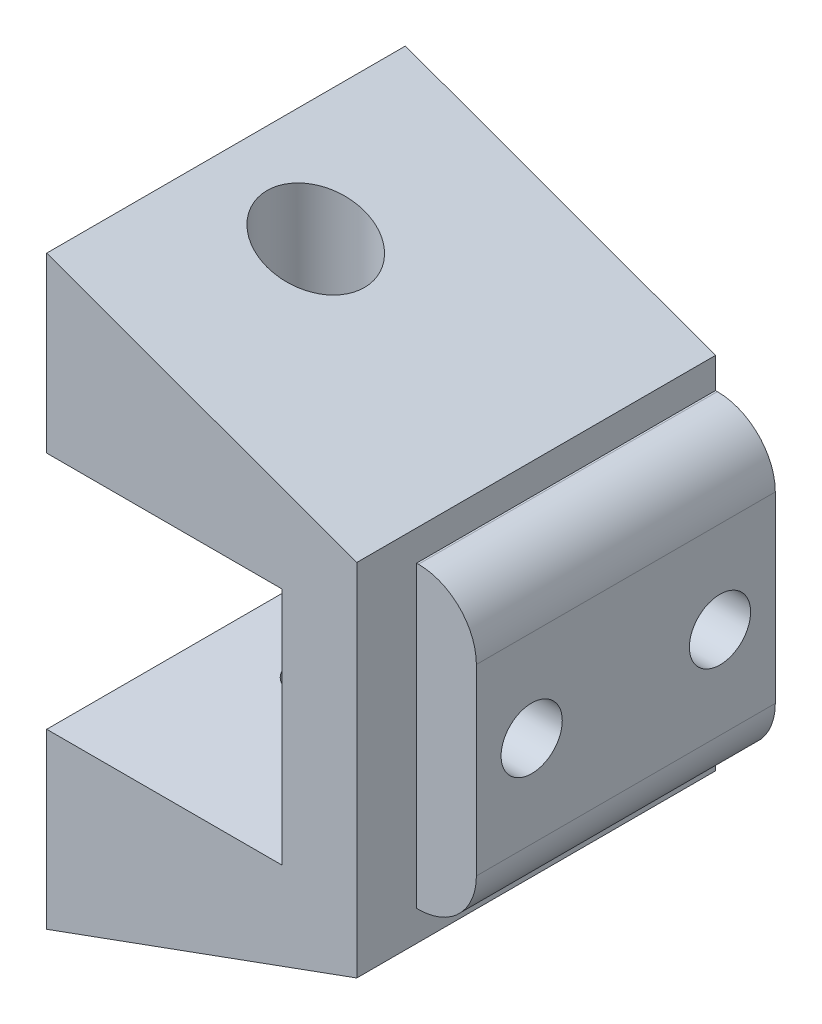
from build123d import *

# Parameters (mm, degrees)
SKETCH3_W           = 50.8
SKETCH3_H           = 30.48
BOSS_EXTRUDE1_DEPTH = 6.35
SKETCH4_W           = 15.24
SKETCH4_H           = 30.48
BOSS_EXTRUDE2_DEPTH = 20
SKETCH5_R           = 4.135
CUT_EXTRUDE1_DEPTH  = 10.668
SKETCH6_R           = 2.35
CUT_EXTRUDE2_DEPTH  = 8
CUT_EXTRUDE3_START  = -10.668
SKETCH7_R           = 4.135
CUT_EXTRUDE3_DEPTH  = 10.668
SKETCH8_R           = 2.135
CUT_EXTRUDE4_DEPTH  = 8
SKETCH10_W          = 25.4
SKETCH10_H          = 25.4
SKETCH10_R          = 2.6
BOSS_EXTRUDE4_DEPTH = 5.08
CHAMFER1_SIZE       = 10.111093108
CHAMFER1_SIZE_2     = 27.78
FILLET2_R           = 4.92
SKETCH12_R          = 2.6
CUT_EXTRUDE6_DEPTH  = 48.353389985
SKETCH13_R          = 2.6
CUT_EXTRUDE7_DEPTH  = 48.353389985


with BuildPart() as part:
    # Sketch3 → Boss-Extrude1 (new body)
    with BuildSketch(Plane.YZ):
        with Locations((0, 15.24)):
            Rectangle(SKETCH3_W, SKETCH3_H)
    extrude(amount=BOSS_EXTRUDE1_DEPTH)

    # Sketch4 → Boss-Extrude2 (add)
    with BuildSketch(Plane(origin=(0, 0, 0), x_dir=(0, -1, 0), z_dir=(-1, 0, 0))):
        with Locations((-17.78, 15.24)):
            Rectangle(SKETCH4_W, SKETCH4_H)
        with Locations((17.78, 15.24)):
            Rectangle(SKETCH4_W, SKETCH4_H)
    extrude(amount=BOSS_EXTRUDE2_DEPTH)

    # Sketch5 → Cut-Extrude1 (cut)
    with BuildSketch(Plane(origin=(0, 25.4, 0), x_dir=(-1, 0, 0), z_dir=(0, 1, 0))):
        with Locations(Location((12.38, 15.24, 0), (0, 0, 90))):
            Circle(SKETCH5_R)
    extrude(amount=-CUT_EXTRUDE1_DEPTH, mode=Mode.SUBTRACT)

    # Sketch6 → Cut-Extrude2 (cut)
    with BuildSketch(Plane(origin=(0, 14.732, 0), x_dir=(-1, 0, 0), z_dir=(0, 1, 0))):
        with Locations(Location((12.38, 15.24, 0), (0, 0, 90))):
            Circle(SKETCH6_R)
    extrude(amount=-CUT_EXTRUDE2_DEPTH, mode=Mode.SUBTRACT)

    # Sketch7 → Cut-Extrude3 (cut)
    with BuildSketch(Plane.XZ.offset(25.4).offset(CUT_EXTRUDE3_START)):
        with Locations(Location((-12.38, 15.24, 0), (0, 0, 90))):
            Circle(SKETCH7_R)
    extrude(amount=CUT_EXTRUDE3_DEPTH, mode=Mode.SUBTRACT)

    # Sketch8 → Cut-Extrude4 (cut)
    with BuildSketch(Plane.XZ.offset(14.732)):
        with Locations(Location((-12.38, 15.24, 0), (0, 0, 270))):
            Circle(SKETCH8_R)
    extrude(amount=-CUT_EXTRUDE4_DEPTH, mode=Mode.SUBTRACT)

    # Sketch10 → Boss-Extrude4 (add)
    with BuildSketch(Plane.YZ.offset(6.35)):
        with Locations((0, 12.7)):
            Rectangle(SKETCH10_W, SKETCH10_H)
        with Locations(Location((0, 20.701, 0), (0, 0, 270))):
            Circle(SKETCH10_R, mode=Mode.SUBTRACT)
        with Locations(Location((0, 4.701, 0), (0, 0, 270))):
            Circle(SKETCH10_R, mode=Mode.SUBTRACT)
    extrude(amount=BOSS_EXTRUDE4_DEPTH)

    # Chamfer1
    # the kernel refuses this chamfer: 27.78, 10.111093108 mm, written as the material it takes off along each edge
    with BuildSketch(Plane(origin=(6.35, 25.4, 102.54672967), x_dir=(0.09904090225204921, -0.9950833631817487, 0), z_dir=(0, 0, -1)), Plane(origin=(6.35, -25.4, -72.06672967), x_dir=(0.09904090225204921, 0.9950833631817487, 0), z_dir=(0, 0, 1))) as chamfer1_piece_1:
        Polygon((CHAMFER1_SIZE * 0.995083363173, CHAMFER1_SIZE * 0.0990409022512), (-CHAMFER1_SIZE_2 * 0.099040902252, CHAMFER1_SIZE_2 * 0.995083363182), (0, 0), align=None)
    extrude(amount=174.613459341, mode=Mode.SUBTRACT)

    # Fillet2
    fillet2_edges = [part.edges().sort_by_distance(p)[0] for p in [
        (11.43, -12.7, 12.7),
        (11.43, 12.7, 12.7),
    ]]
    fillet(fillet2_edges, radius=FILLET2_R)

    # Sketch12 → Cut-Extrude6 (cut, through all)
    with BuildSketch(Plane.YZ.offset(6.35)):
        with Locations(Location((0, 20.701, 0), (0, 0, 270))):
            Circle(SKETCH12_R)
    extrude(amount=-CUT_EXTRUDE6_DEPTH, mode=Mode.SUBTRACT)

    # Sketch13 → Cut-Extrude7 (cut, through all)
    with BuildSketch(Plane.YZ.offset(6.35)):
        with Locations(Location((0, 4.701, 0), (0, 0, 270))):
            Circle(SKETCH13_R)
    extrude(amount=-CUT_EXTRUDE7_DEPTH, mode=Mode.SUBTRACT)


solid = part.part
